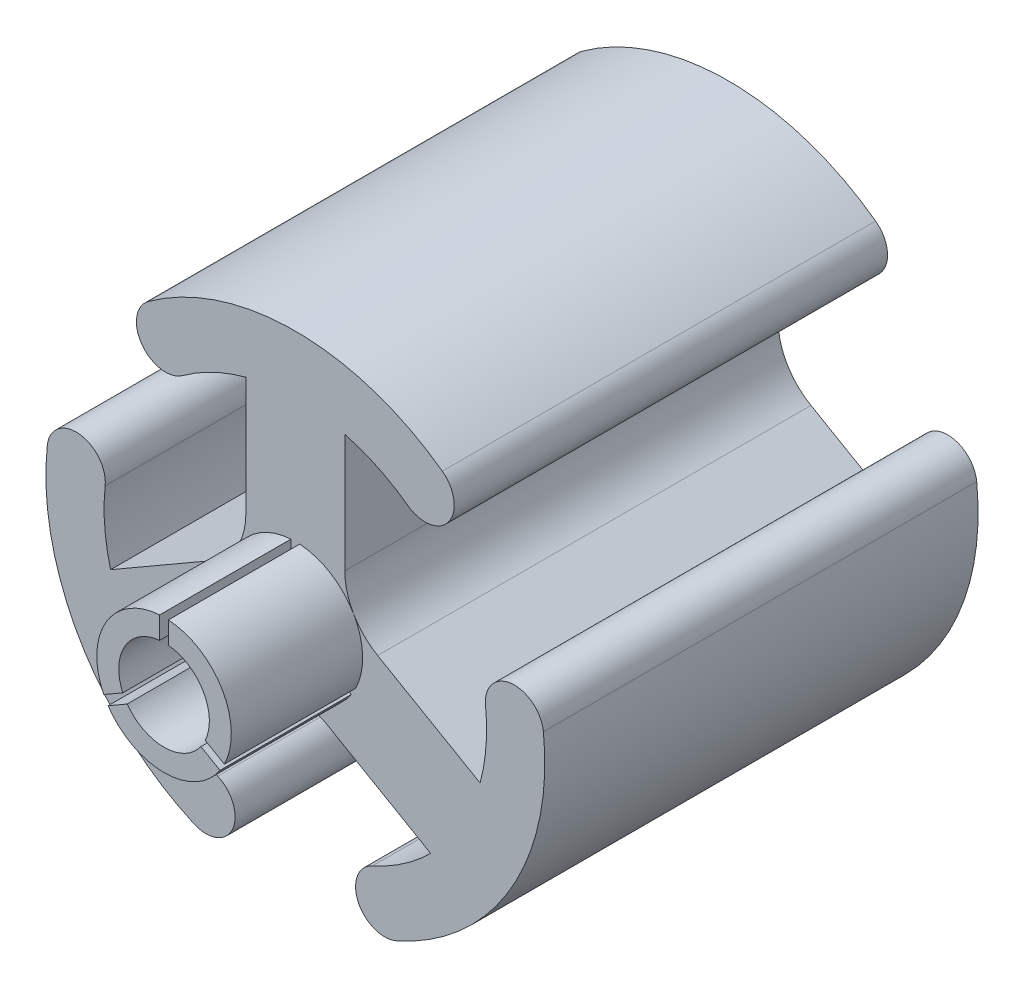
from build123d import *

# Parameters (mm, degrees)
BOSS_EXTRUDE3_DEPTH = 33
CIRPATTERN1_COUNT   = 3
FILLET1_R           = 5
BOSS_EXTRUDE4_DEPTH = 10
SKETCH6_R           = 3.45
CUT_EXTRUDE1_DEPTH  = 50


with BuildPart() as part:
    # Sketch2 → Boss-Extrude3 (new body)
    with BuildSketch(Plane.XY):
        with BuildLine():
            ThreePointArc((-11.191746167, 15.353983774), (-11.677300028, 12.257240413), (-8.580556666, 11.771686551))
            ThreePointArc((-8.580556666, 11.771686551), (-6.280006751, 13.143822586), (-3.767104533, 14.071513081))
            Line((-3.767104533, 14.071513081), (-3.767104533, 0))
            Line((-3.767104533, 0), (3.767104533, 0))
            Line((3.767104533, 0), (3.767104533, 14.071513081))
            ThreePointArc((3.767104533, 14.071513081), (6.280006751, 13.143822586), (8.580556666, 11.771686551))
            ThreePointArc((8.580556666, 11.771686551), (11.677300028, 12.257240413), (11.191746167, 15.353983774))
            ThreePointArc((11.191746167, 15.353983774), (0, 19), (-11.191746167, 15.353983774))
        make_face()
    extrude(amount=-BOSS_EXTRUDE3_DEPTH)

    # CirPattern1: part ×3 about axis
    cirpattern1_axis = Axis((0, 0, 0), (0, 0, -1))


with BuildPart() as part_1:
    add(part.part)
    for i in range(1, CIRPATTERN1_COUNT):
        add(part.part.rotate(cirpattern1_axis, i * 360 / CIRPATTERN1_COUNT))

    # Fillet1
    fillet1_edges = [part_1.edges().sort_by_distance(p)[0] for p in [
        (3.767104533, 2.174938816, -16.5),
        (0, -4.349877632, -16.5),
        (-3.767104533, 2.174938816, -16.5),
    ]]
    fillet(fillet1_edges, radius=FILLET1_R)

    # Sketch7 → Boss-Extrude4 (add)
    with BuildSketch(Plane.XY):
        with BuildLine():
            Line((4.261966622, -2.843354789), (0.924619042, -0.916536265))
            Line((0.924619042, -0.916536265), (1.25605321, -0.342475447))
            Line((1.25605321, -0.342475447), (4.59340079, -2.269293971))
            ThreePointArc((4.59340079, -2.269293971), (4.989126435, -1.165179539), (5.123380324, 0))
            ThreePointArc((5.123380324, 0), (3.738120466, 3.503638298), (0.331434168, 5.11264876))
            Line((0.331434168, 5.11264876), (0.331434168, 1.259011712))
            Line((0.331434168, 1.259011712), (-0.331434168, 1.259011712))
            Line((-0.331434168, 1.259011712), (-0.331434168, 5.11264876))
            ThreePointArc((-0.331434168, 5.11264876), (-4.436977514, 2.561690162), (-4.59340079, -2.269293971))
            Line((-4.59340079, -2.269293971), (-1.25605321, -0.342475447))
            Line((-1.25605321, -0.342475447), (-0.924619042, -0.916536265))
            Line((-0.924619042, -0.916536265), (-4.261966622, -2.843354789))
            ThreePointArc((-4.261966622, -2.843354789), (0, -5.123380324), (4.261966622, -2.843354789))
        make_face()
    extrude(amount=BOSS_EXTRUDE4_DEPTH)

    # Sketch6 → Cut-Extrude1 (cut)
    with BuildSketch(Plane(origin=(0, 0, -33), x_dir=(-1, 0, 0), z_dir=(0, 0, -1))):
        Circle(SKETCH6_R)
    extrude(amount=-CUT_EXTRUDE1_DEPTH, mode=Mode.SUBTRACT)


solid = part_1.part
